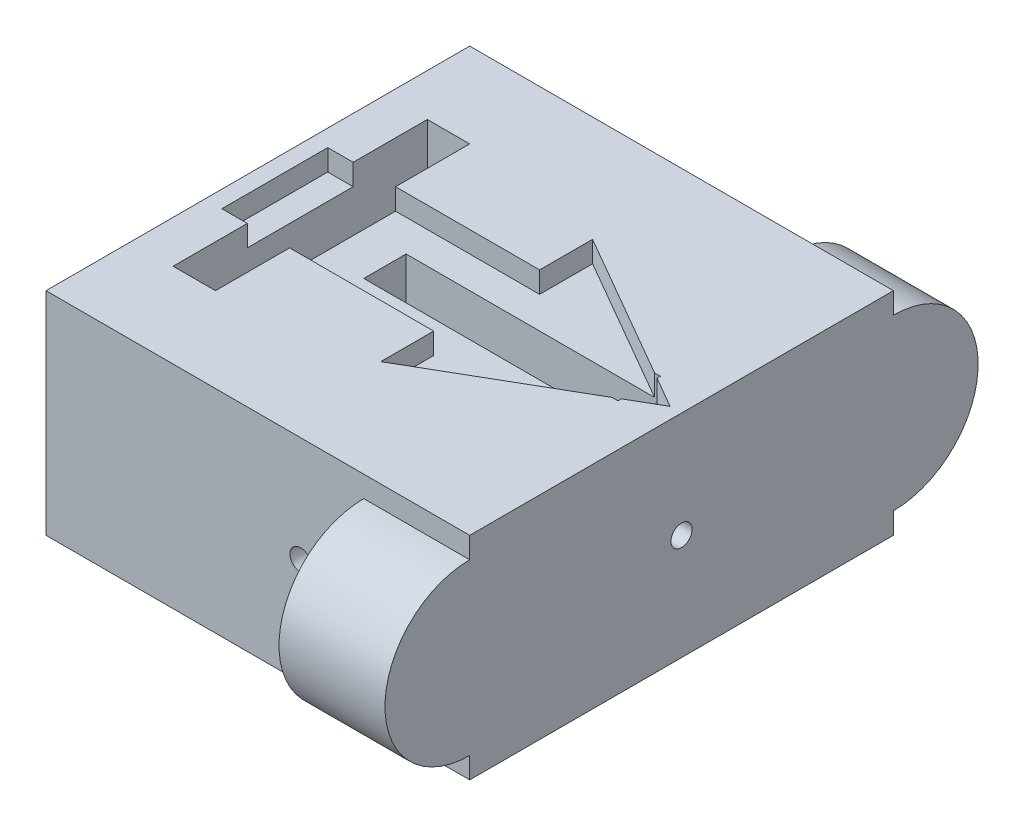
from build123d import *

# Parameters (mm, degrees)
SKETCH1_W           = 200
SKETCH1_H           = 200
BOSS_EXTRUDE2_DEPTH = 100
SKETCH2_R           = 40
BOSS_EXTRUDE3_DEPTH = 50
CUT_EXTRUDE1_DEPTH  = 10
SKETCH4_W           = 120
SKETCH4_H           = 20
SKETCH4_W_2         = 20
SKETCH4_H_2         = 120
CUT_EXTRUDE2_DEPTH  = 199.997487421
SKETCH5_R           = 5
CUT_EXTRUDE3_DEPTH  = 279.567765544
SKETCH6_R           = 5
CUT_EXTRUDE4_DEPTH  = 264.818119165


with BuildPart() as part:
    # Sketch1 → Boss-Extrude2 (new body)
    with BuildSketch(Plane(origin=(0, 0, 0), x_dir=(1, 0, 0), z_dir=(0, 1, 0))):
        Rectangle(SKETCH1_W, SKETCH1_H)
    extrude(amount=BOSS_EXTRUDE2_DEPTH)

    # Sketch2 → Boss-Extrude3 (add)
    with BuildSketch(Plane.ZY.offset(-100)):
        with Locations((100, 50)):
            Circle(SKETCH2_R)
        with Locations((-100, 50)):
            Circle(SKETCH2_R)
    extrude(amount=BOSS_EXTRUDE3_DEPTH)

    # Sketch3 → Cut-Extrude1 (cut)
    with BuildSketch(Plane(origin=(0, 100, 0), x_dir=(1, 0, 0), z_dir=(0, 1, 0))):
        Polygon((8, 25), (8, 50), (94.602540378, 0), (8, -50), (8, -25), (-92, -25), (-92, 25), align=None)
    extrude(amount=-CUT_EXTRUDE1_DEPTH, mode=Mode.SUBTRACT)

    # Sketch4 → Cut-Extrude2 (cut, through all)
    with BuildSketch(Plane(origin=(0, 100, 0), x_dir=(1, 0, 0), z_dir=(0, 1, 0))):
        with Locations((20, 0)):
            Rectangle(SKETCH4_W, SKETCH4_H)
        with Locations((-70, 0)):
            Rectangle(SKETCH4_W_2, SKETCH4_H_2)
    extrude(amount=-CUT_EXTRUDE2_DEPTH, mode=Mode.SUBTRACT)

    # Sketch5 → Cut-Extrude3 (cut, through all)
    with BuildSketch(Plane.XY.offset(100)):
        with Locations((20.147207668, 50)):
            Circle(SKETCH5_R)
    extrude(amount=-CUT_EXTRUDE3_DEPTH, mode=Mode.SUBTRACT)

    # Sketch6 → Cut-Extrude4 (cut, through all)
    with BuildSketch(Plane.ZY.offset(100)):
        with Locations((0, 50)):
            Circle(SKETCH6_R)
    extrude(amount=-CUT_EXTRUDE4_DEPTH, mode=Mode.SUBTRACT)


solid = part.part
